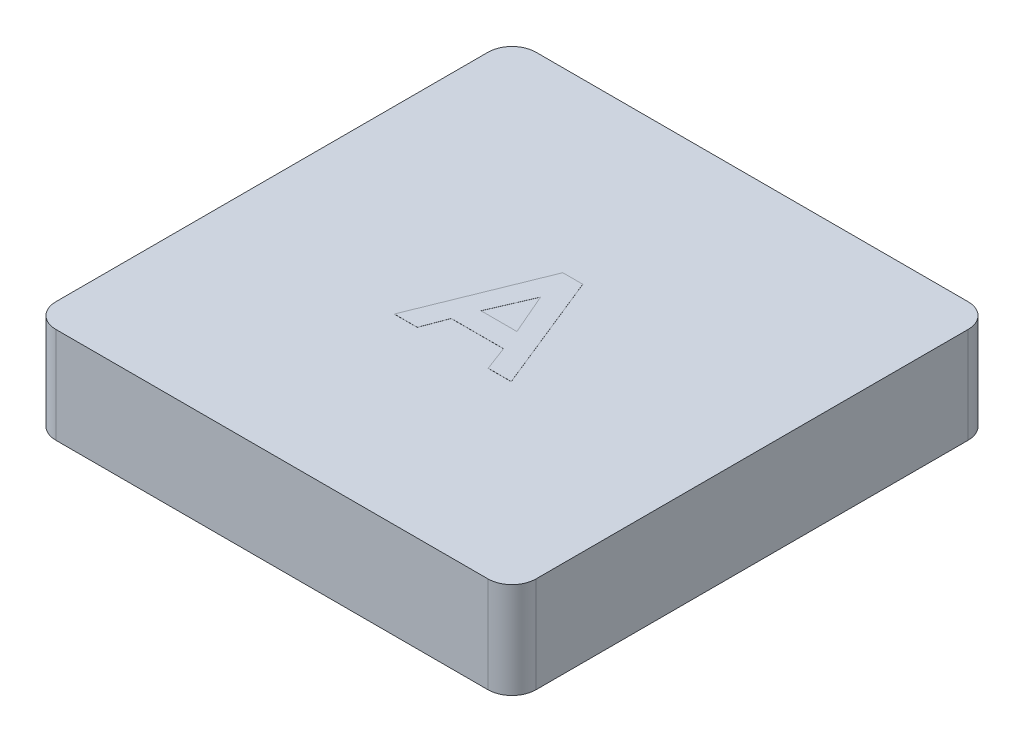
from build123d import *

# Parameters (mm, degrees)
SKETCH1_W           = 12.7
SKETCH1_H           = 12.7
BOSS_EXTRUDE1_DEPTH = 2.54
FILLET1_R           = 0.635
SHELL1_START        = 0.635
SHELL1_OUTLINE_W    = 1.905
SHELL1_OUTLINE_H    = 11.43
SHELL1_DEPTH        = 11.43
SKETCH2_R           = 2.54
BOSS_EXTRUDE2_DEPTH = 1.905
BOSS_EXTRUDE3_DEPTH = 0.00254


# Read off the part's stored shape, not the designer's step: Shell1
with BuildPart() as part:
    # Sketch1 → Boss-Extrude1 (new body)
    with BuildSketch(Plane(origin=(0, 0, 0), x_dir=(1, 0, 0), z_dir=(0, 1, 0))):
        with Locations((6.35, 6.35)):
            Rectangle(SKETCH1_W, SKETCH1_H)
    extrude(amount=BOSS_EXTRUDE1_DEPTH)

    # Fillet1
    fillet1_edges = [part.edges().sort_by_distance(p)[0] for p in [
        (0, 1.27, -12.7),
        (12.7, 1.27, -12.7),
        (12.7, 1.27, 0),
        (0, 1.27, 0),
    ]]
    fillet(fillet1_edges, radius=FILLET1_R)

    # Shell1 outline → Shell1 (cut)
    with BuildSketch(Plane.YZ.offset(SHELL1_START)):
        with Locations((0.9525, -6.35)):
            Rectangle(SHELL1_OUTLINE_W, SHELL1_OUTLINE_H)
    extrude(amount=SHELL1_DEPTH, mode=Mode.SUBTRACT)

    # Sketch2 → Boss-Extrude2 (add)
    with BuildSketch(Plane(origin=(0, 1.905, 0), x_dir=(-1, 0, 0), z_dir=(0, -1, 0))):
        with Locations(Location((-6.35, 6.35, 0), (0, 0, 270))):
            Circle(SKETCH2_R)
    extrude(amount=BOSS_EXTRUDE2_DEPTH)

    # Sketch3 → Boss-Extrude3 (add)
    with BuildSketch(Plane(origin=(0, 2.54, 0), x_dir=(1, 0, 0), z_dir=(0, 1, 0))):
        Polygon((6.042905248, 8.001), (6.571435897, 8.001), (7.853647436, 4.826), (7.244978566, 4.826), (6.998203726, 5.477282051), (5.614865385, 5.477282051), (5.368090545, 4.826), (4.760057692, 4.826), align=None)
        Polygon((6.306852564, 7.149372396), (5.831111378, 6.047153846), (6.78259375, 6.047153846), align=None, mode=Mode.SUBTRACT)
    extrude(amount=BOSS_EXTRUDE3_DEPTH)


solid = part.part
